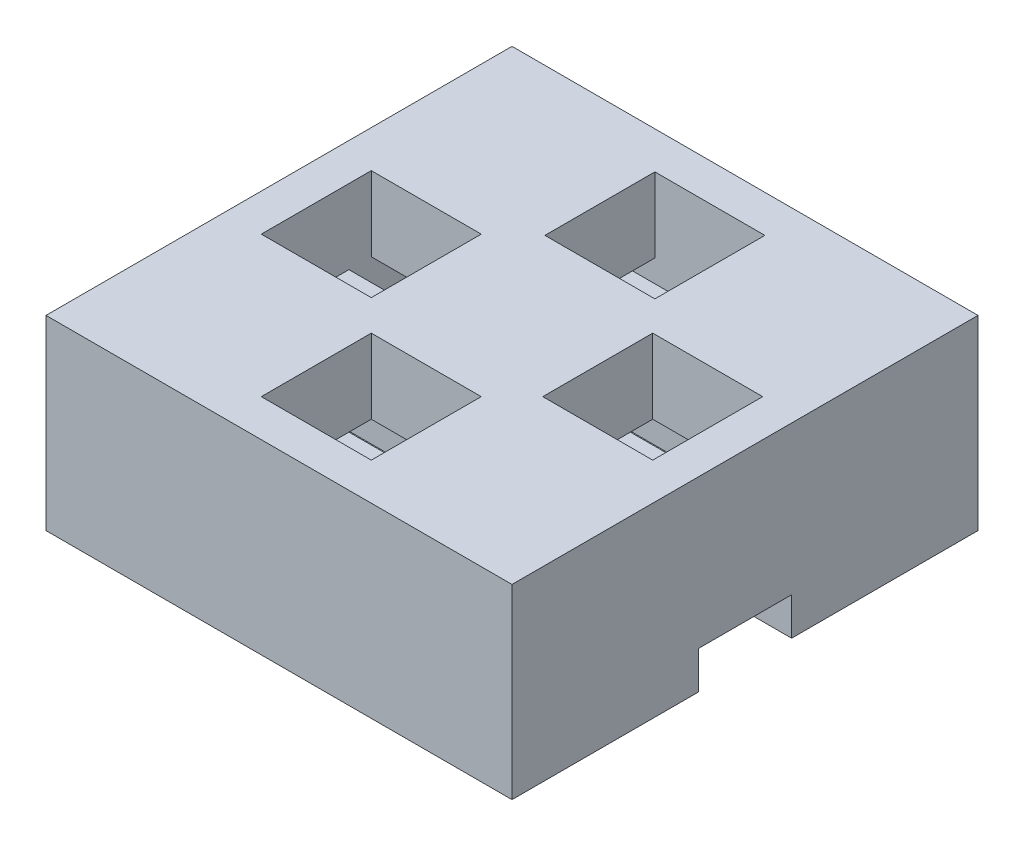
from build123d import *

# Parameters (mm, degrees)
SKETCH1_W           = 50
SKETCH1_H           = 50
SKETCH1_W_2         = 11.8
SKETCH1_H_2         = 11.8
BOSS_EXTRUDE1_DEPTH = 8
SKETCH2_W           = 50
SKETCH2_H           = 50
BOSS_EXTRUDE7_DEPTH = 12
SKETCH2_5_W         = 23.6
SKETCH2_5_H         = 7
SKETCH2_5_W_2       = 42
BOSS_EXTRUDE8_DEPTH = 8
SKETCH3_W           = 10
SKETCH3_H           = 4.043108788
CUT_EXTRUDE1_DEPTH  = 8


with BuildPart() as part:
    # Sketch1 → Boss-Extrude1 (new body)
    with BuildSketch(Plane(origin=(0, 0, 0), x_dir=(1, 0, 0), z_dir=(0, 1, 0))):
        Rectangle(SKETCH1_W, SKETCH1_H)
        with Locations((0.231980124, 15.1)):
            Rectangle(SKETCH1_W_2, SKETCH1_H_2, mode=Mode.SUBTRACT)
        with Locations((15.1, 0)):
            Rectangle(SKETCH1_W_2, SKETCH1_H_2, mode=Mode.SUBTRACT)
        with Locations((-15.1, 0)):
            Rectangle(SKETCH1_W_2, SKETCH1_H_2, mode=Mode.SUBTRACT)
        with Locations((0, -15.1)):
            Rectangle(SKETCH1_W_2, SKETCH1_H_2, mode=Mode.SUBTRACT)
    extrude(amount=BOSS_EXTRUDE1_DEPTH)

    # Sketch2 → Boss-Extrude7 (add)
    with BuildSketch(Plane.XZ):
        Rectangle(SKETCH2_W, SKETCH2_H)
        Polygon((-21, 21), (-5.9, 21), (5.9, 21), (21, 21), (21, 5.9), (21, 3.5), (21, -3.5), (21, -5.9), (21, -21), (6.131980124, -21), (-5.668019876, -21), (-21, -21), (-21, -5.9), (-21, -3.5), (-21, 3.5), (-21, 5.9), align=None, mode=Mode.SUBTRACT)
    extrude(amount=BOSS_EXTRUDE7_DEPTH)

    # Sketch2<5> → Boss-Extrude8 (add)
    with BuildSketch(Plane.XZ):
        with Locations((0, 15.1)):
            Rectangle(SKETCH2_5_W, SKETCH2_5_H)
        Rectangle(SKETCH2_5_W_2, SKETCH2_5_H)
        with Locations((0.231980124, -15.1)):
            Rectangle(SKETCH2_5_W, SKETCH2_5_H)
    extrude(amount=BOSS_EXTRUDE8_DEPTH)

    # Sketch3 → Cut-Extrude1 (cut)
    with BuildSketch(Plane.ZY.offset(-21)):
        with Locations((0, -9.978445606)):
            Rectangle(SKETCH3_W, SKETCH3_H)
    extrude(amount=-CUT_EXTRUDE1_DEPTH, mode=Mode.SUBTRACT)


solid = part.part
